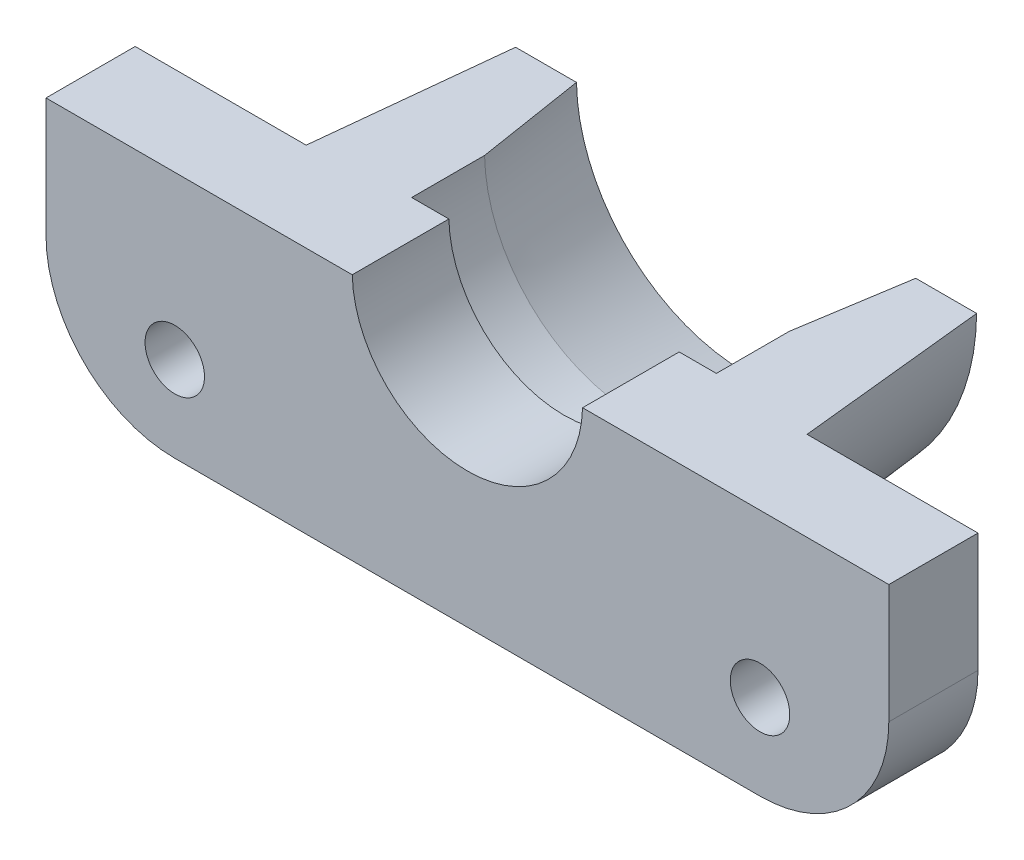
from build123d import *
from OCP.BRepAlgoAPI import BRepAlgoAPI_Cut
from OCP.TopTools import TopTools_ListOfShape

# Parameters (mm, degrees)
BOSS_EXTRUDE2_DEPTH      = 22.67949
BOSS_EXTRUDE2_DEPTH_BACK = 22.67949
SKETCH5_R                = 1.6
CUT_EXTRUDE1_DEPTH       = 29.214793281


with BuildPart() as part:
    # Sketch3 → Boss-Extrude2 (new, two sides: drawn at the far end of the back side and taken through both)
    with BuildSketch(Plane(origin=(0, 0, 0), x_dir=(0, 0, -1), z_dir=(1, 0, 0)).offset(-BOSS_EXTRUDE2_DEPTH_BACK)):
        Polygon((4.8, -13.329489609), (0, -13.329489609), (0, 0), (15, 0), (15, -12.25742641), align=None)
    extrude(amount=BOSS_EXTRUDE2_DEPTH + BOSS_EXTRUDE2_DEPTH_BACK)

    # Sketch2 → Cut-Revolve1 (revolve, cut)
    with BuildSketch(Plane(origin=(0, 0, 0), x_dir=(0, 0, -1), z_dir=(1, 0, 0))):
        Polygon((15, 0.15), (0, 0.15), (0, -6.05), (5.2, -6.05), (5.2, -8.05), (9.121020847, -8.05), (15, -8.981138823), align=None)
    revolve(axis=Axis((0, 0.15, -15), (0, 0, 1)), mode=Mode.SUBTRACT)

    # Sketch4 → Cut-Revolve2 (revolve, cut)
    with BuildSketch(Plane(origin=(0, 0.15, -14), x_dir=(0, 0, -1), z_dir=(1, 0, 0))):
        Polygon((1, 12.40742641), (-9.2, 13.479489609), (-9.2, 37.679985647), (1, 37.679985647), align=None)
    revolve(axis=Axis((0, 0.15, -14), (0, 0, 1)), mode=Mode.SUBTRACT)


with BuildPart() as cut_extrude1_tool:
    # Sketch5 → Cut-Extrude1 (new, through all)
    with BuildSketch(Plane(origin=(0, 0, -4.8), x_dir=(-1, 0, 0), z_dir=(0, 0, -1))):
        with Locations(Location((-15.748733562, -8.729489609, 0), (0, 0, 90))):
            Circle(SKETCH5_R)
        with Locations(Location((15.748733562, -8.729489609, 0), (0, 0, 270))):
            Circle(SKETCH5_R)
        with BuildLine():
            Line((-22.679489609, -13.329489609), (-22.679489609, -6.398733562))
            ThreePointArc((-22.679489609, -6.398733562), (-20.649518162, -11.299518162), (-15.748733562, -13.329489609))
            Line((-15.748733562, -13.329489609), (-22.679489609, -13.329489609))
        make_face()
        with BuildLine():
            Line((22.679489609, -13.329489609), (22.679489609, -6.398733562))
            ThreePointArc((22.679489609, -6.398733562), (20.649518162, -11.299518162), (15.748733562, -13.329489609))
            Line((15.748733562, -13.329489609), (22.679489609, -13.329489609))
        make_face()
    extrude(amount=-CUT_EXTRUDE1_DEPTH)


with BuildPart() as part_1:
    add(part.part)

    # Cut-Extrude1: cut by cut_extrude1_tool, with a tolerance
    cut_extrude1_stock = TopTools_ListOfShape()
    cut_extrude1_stock.Append(part_1.part.wrapped)
    cut_extrude1_tools = TopTools_ListOfShape()
    cut_extrude1_tools.Append(cut_extrude1_tool.part.wrapped)
    cut_extrude1_cut = BRepAlgoAPI_Cut()
    cut_extrude1_cut.SetArguments(cut_extrude1_stock)
    cut_extrude1_cut.SetTools(cut_extrude1_tools)
    cut_extrude1_cut.SetFuzzyValue(0.00001)
    cut_extrude1_cut.Build()
    add(Compound.cast(cut_extrude1_cut.Shape()).solids(), mode=Mode.REPLACE)


solid = part_1.part
